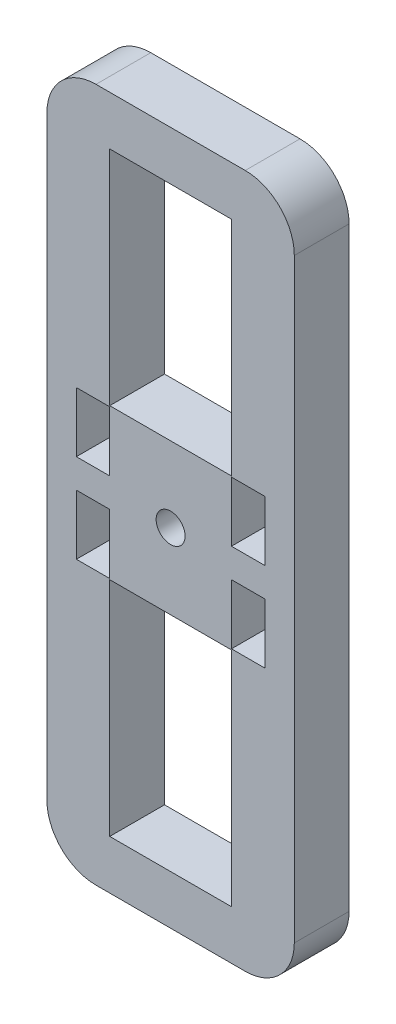
from build123d import *

# Parameters (mm, degrees)
SKETCH1_W           = 3.4
SKETCH1_H           = 6.1
SKETCH1_W_2         = 12.4
SKETCH1_H_2         = 22.65
SKETCH1_R           = 1.475
BOSS_EXTRUDE1_DEPTH = 5.58


with BuildPart() as part:
    # Sketch1 → Boss-Extrude1 (new body)
    with BuildSketch(Plane.XY):
        with BuildLine():
            Line((708.095729089, 432.629671907), (715.695729089, 432.629671907))
            Line((715.695729089, 432.629671907), (723.295729089, 432.629671907))
            ThreePointArc((723.295729089, 432.629671907), (726.831262995, 434.094138001), (728.295729089, 437.629671907))
            Line((728.295729089, 437.629671907), (728.295729089, 498.279671907))
            ThreePointArc((728.295729089, 498.279671907), (726.831262995, 501.815205812), (723.295729089, 503.279671907))
            Line((723.295729089, 503.279671907), (715.695729089, 503.279671907))
            Line((715.695729089, 503.279671907), (708.095729089, 503.279671907))
            ThreePointArc((708.095729089, 503.279671907), (704.560195183, 501.815205812), (703.095729089, 498.279671907))
            Line((703.095729089, 498.279671907), (703.095729089, 437.629671907))
            ThreePointArc((703.095729089, 437.629671907), (704.560195183, 434.094138001), (708.095729089, 432.629671907))
        make_face()
        with Locations((707.795729089, 463.429671907)):
            Rectangle(SKETCH1_W, SKETCH1_H, mode=Mode.SUBTRACT)
        with Locations((715.695729089, 448.954671907)):
            Rectangle(SKETCH1_W_2, SKETCH1_H_2, mode=Mode.SUBTRACT)
        with Locations((723.595729089, 463.429671907)):
            Rectangle(SKETCH1_W, SKETCH1_H, mode=Mode.SUBTRACT)
        with Locations((707.795729089, 472.479671907)):
            Rectangle(SKETCH1_W, SKETCH1_H, mode=Mode.SUBTRACT)
        with Locations((715.695729089, 467.954671907)):
            Circle(SKETCH1_R, mode=Mode.SUBTRACT)
        with Locations((723.595729089, 472.479671907)):
            Rectangle(SKETCH1_W, SKETCH1_H, mode=Mode.SUBTRACT)
        with Locations((715.695729089, 486.954671907)):
            Rectangle(SKETCH1_W_2, SKETCH1_H_2, mode=Mode.SUBTRACT)
    extrude(amount=BOSS_EXTRUDE1_DEPTH)


solid = part.part
